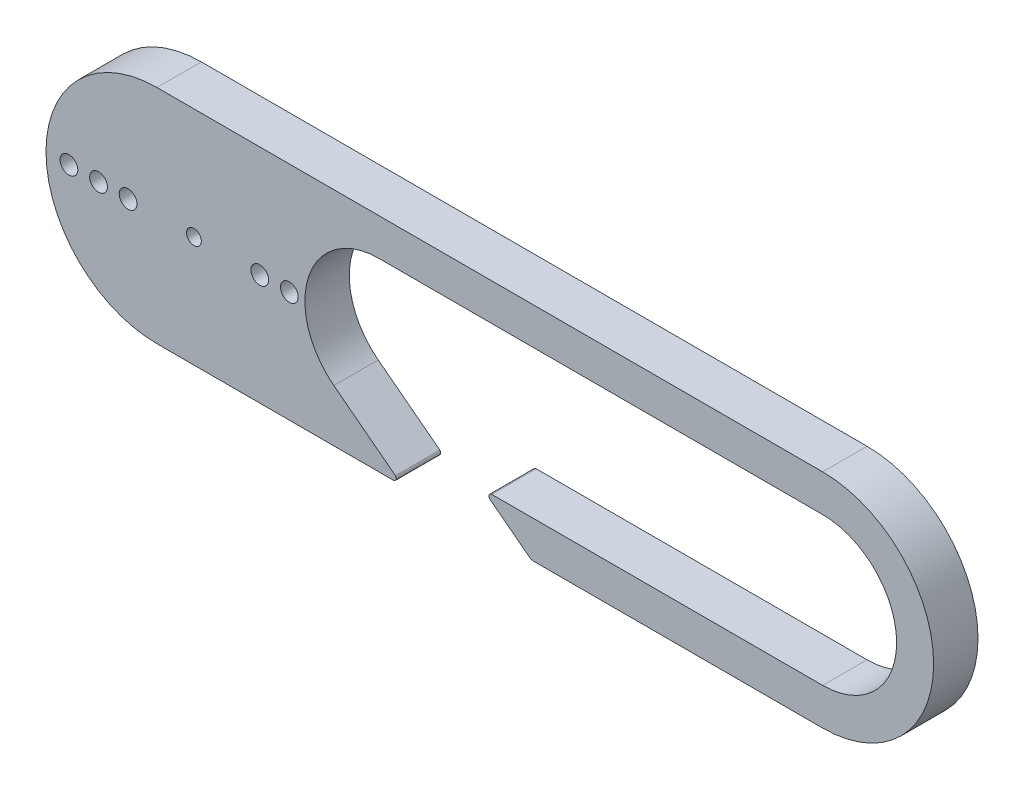
from build123d import *

# Parameters (mm, degrees)
BOSS_EXTRUDE1_DEPTH     = 3
CUT_EXTRUDE1_DEPTH      = 55.99172744
CUT_EXTRUDE1_DEPTH_BACK = 55.99172744
SKETCH3_R               = 0.6
SKETCH3_R_2             = 0.500728048


with BuildPart() as part:
    # Sketch2 → Boss-Extrude1 (new body)
    with BuildSketch(Plane.XY):
        with BuildLine():
            ThreePointArc((13.72796065, -3.112181063), (12.035436414, 2.462021021), (16.770370099, 5.855657737))
            Line((16.770370099, 5.855657737), (46.770370099, 5.855657737))
            ThreePointArc((46.770370099, 5.855657737), (51.770370099, 0.855657737), (46.770370099, -4.144342263))
            Line((46.770370099, -4.144342263), (24.407279181, -4.144342263))
            ThreePointArc((24.407279181, -4.144342263), (24.217881833, -4.280087732), (24.285582803, -4.503055815))
            Line((24.285582803, -4.503055815), (26.943586158, -6.541126143))
            ThreePointArc((26.943586158, -6.541126143), (27.087190775, -6.617835631), (27.247827103, -6.644342263))
            Line((27.247827103, -6.644342263), (46.770370099, -6.644342263))
            ThreePointArc((46.770370099, -6.644342263), (54.270370099, 0.855657737), (46.770370099, 8.355657737))
            Line((46.770370099, 8.355657737), (1.770370099, 8.355657737))
            ThreePointArc((1.770370099, 8.355657737), (-5.729629901, 0.855657737), (1.770370099, -6.644342263))
            Line((1.770370099, -6.644342263), (17.747827103, -6.644342263))
            ThreePointArc((17.747827103, -6.644342263), (17.93260301, -6.520878949), (17.889248459, -6.302920907))
            Line((17.889248459, -6.302920907), (13.72796065, -3.112181063))
        make_face()
    extrude(amount=BOSS_EXTRUDE1_DEPTH)

    # Sketch3 → Cut-Extrude1 (cut, two sides: drawn at the far end of the back side and taken through both)
    with BuildSketch(Plane.XY.offset(3).offset(-CUT_EXTRUDE1_DEPTH_BACK)):
        with Locations((-4.179629901, 0.855657737)):
            Circle(SKETCH3_R)
        with Locations((-2.179629901, 0.855657737)):
            Circle(SKETCH3_R)
        with Locations((-0.179629901, 0.855657737)):
            Circle(SKETCH3_R)
        with Locations((4.270370099, 0.855657737)):
            Circle(SKETCH3_R_2)
        with Locations((8.720370099, 0.855657737)):
            Circle(SKETCH3_R)
        with Locations((10.720370099, 0.855657737)):
            Circle(SKETCH3_R)
        with Locations((12.720370099, 0.855657737)):
            Circle(SKETCH3_R)
    extrude(amount=CUT_EXTRUDE1_DEPTH + CUT_EXTRUDE1_DEPTH_BACK, mode=Mode.SUBTRACT)


solid = part.part
